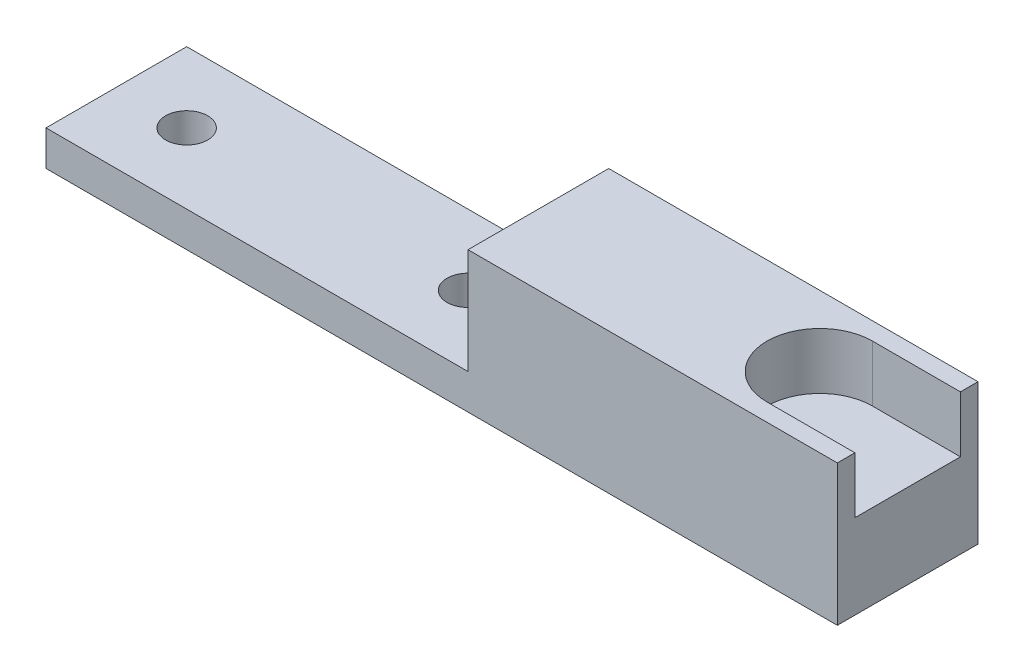
from build123d import *

# Parameters (mm, degrees)
SKETCH1_W             = 71.4375
SKETCH1_H             = 12.7
BOSS_EXTRUDE1_DEPTH   = 12.7
F_6_CLEARANCE_HOLE2_D = 3.7973
SKETCH6_W             = 38.1
SKETCH6_H             = 9.525
CUT_EXTRUDE1_DEPTH    = 40.980108824
CUT_EXTRUDE2_DEPTH    = 5.08


with BuildPart() as part:
    # Sketch1 → Boss-Extrude1 (new body)
    with BuildSketch(Plane(origin=(0, 0, 0), x_dir=(1, 0, 0), z_dir=(0, 1, 0))):
        Rectangle(SKETCH1_W, SKETCH1_H)
    extrude(amount=BOSS_EXTRUDE1_DEPTH)

    # #6 Clearance Hole2 (through all)
    with Locations(Plane(origin=(0, 0, 0), x_dir=(-1, 0, 0), z_dir=(0, -1, 0))):
        with Locations((29.36875, 0), (3.96875, 0)):
            Hole(F_6_CLEARANCE_HOLE2_D / 2)

    # Sketch6 → Cut-Extrude1 (cut, through all)
    with BuildSketch(Plane.XY.offset(6.35)):
        with Locations((-16.66875, 7.9375)):
            Rectangle(SKETCH6_W, SKETCH6_H)
    extrude(amount=-CUT_EXTRUDE1_DEPTH, mode=Mode.SUBTRACT)

    # Sketch8 → Cut-Extrude2 (cut)
    with BuildSketch(Plane(origin=(0, 12.7, 0), x_dir=(1, 0, 0), z_dir=(0, 1, 0))):
        with BuildLine():
            Line((35.71875, 4.7625), (27.78125, 4.7625))
            ThreePointArc((27.78125, 4.7625), (23.01875, 0), (27.78125, -4.7625))
            Line((27.78125, -4.7625), (35.71875, -4.7625))
            Line((35.71875, -4.7625), (35.71875, 4.7625))
        make_face()
    extrude(amount=-CUT_EXTRUDE2_DEPTH, mode=Mode.SUBTRACT)


solid = part.part
